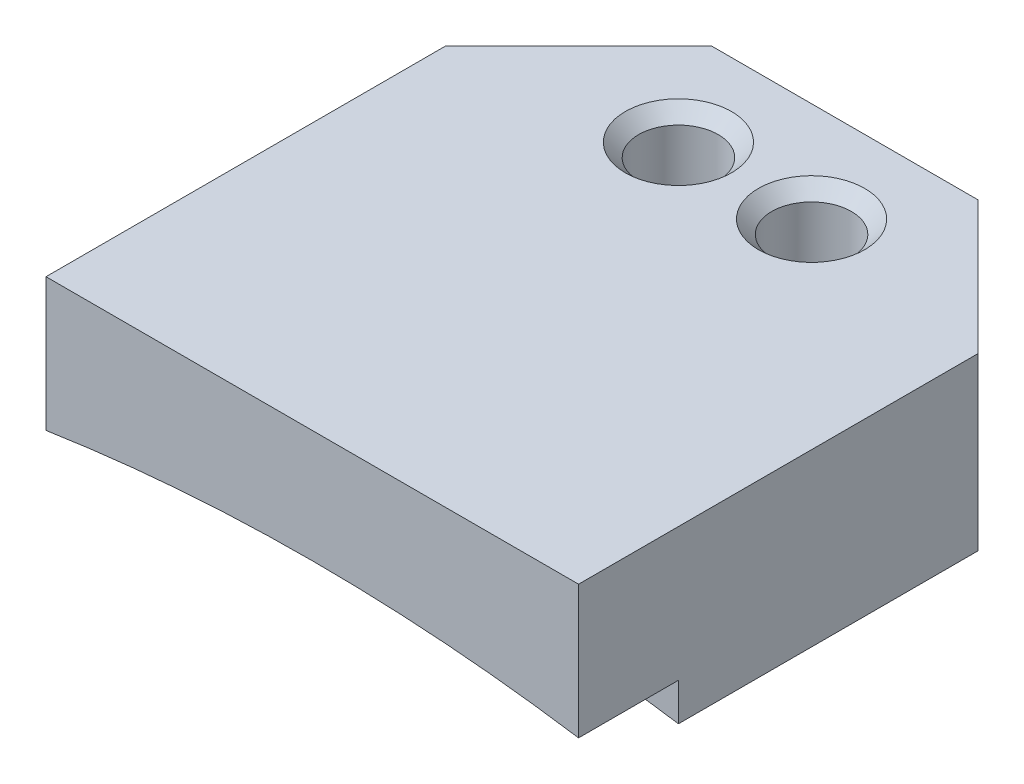
from build123d import *

# Parameters (mm, degrees)
BOSS_EXTRUDE1_DEPTH              = 6.35
CUT_EXTRUDE1_DEPTH               = 39.709258643
CUT_EXTRUDE1_DEPTH_BACK          = 39.709258643
SKETCH2_R                        = 83.82
BOSS_EXTRUDE2_DEPTH              = 20.6375
CHAMFER1_SIZE                    = 6.35
F_10_24_TAPPED_HOLE1_D           = 3.7973
F_10_24_TAPPED_HOLE1_CSINK_D     = 5.0673
F_10_24_TAPPED_HOLE1_CSINK_ANGLE = 90


with BuildPart() as part:
    # Sketch1 → Boss-Extrude1 (new body)
    with BuildSketch(Plane(origin=(0, 0, 0), x_dir=(1, 0, 0), z_dir=(0, 1, 0))):
        Polygon((-28.511825699, 6.495271113), (-22.161825699, 12.845271113), (-9.461825699, 12.845271113), (-3.111825699, 6.495271113), (-3.111825699, -12.554728887), (-28.511825699, -12.554728887), align=None)
    extrude(amount=BOSS_EXTRUDE1_DEPTH)

    # Sketch2 → Cut-Extrude1 (cut, two sides: drawn at the far end of the back side and taken through both)
    with BuildSketch(Plane.XY.offset(12.554728887).offset(-CUT_EXTRUDE1_DEPTH_BACK)):
        with Locations((-15.811825699, -82.852292666)):
            Circle(SKETCH2_R)
    extrude(amount=CUT_EXTRUDE1_DEPTH + CUT_EXTRUDE1_DEPTH_BACK, mode=Mode.SUBTRACT)

    # Sketch5 → Boss-Extrude2 (add)
    with BuildSketch(Plane(origin=(0, 0, -12.845271113), x_dir=(-1, 0, 0), z_dir=(0, 0, -1))):
        with BuildLine():
            Line((3.111825699, 6.35), (3.111825699, 0))
            Line((3.111825699, 0), (3.111825699, -1.799225087))
            ThreePointArc((3.111825699, -1.799225087), (15.811825699, -0.810292666), (28.511825699, -1.799225087))
            Line((28.511825699, -1.799225087), (28.511825699, 0))
            Line((28.511825699, 0), (28.511825699, 6.35))
            Line((28.511825699, 6.35), (3.111825699, 6.35))
        make_face()
    extrude(amount=-BOSS_EXTRUDE2_DEPTH)

    # Chamfer1
    chamfer1_edges = [part.edges().sort_by_distance(p)[0] for p in [
        (-28.511825699, 2.275387457, -12.845271113),
        (-3.111825699, 2.275387457, -12.845271113),
    ]]
    chamfer(chamfer1_edges, length=CHAMFER1_SIZE)

    # #10-24 Tapped Hole1 (through all)
    with Locations(Plane(origin=(0, 6.35, 0), x_dir=(1, 0, 0), z_dir=(0, 1, 0))):
        with Locations((-18.986825699, 8.082771113), (-12.636825699, 8.082771113)):
            CounterSinkHole(F_10_24_TAPPED_HOLE1_D / 2, F_10_24_TAPPED_HOLE1_CSINK_D / 2, counter_sink_angle=F_10_24_TAPPED_HOLE1_CSINK_ANGLE)


solid = part.part
